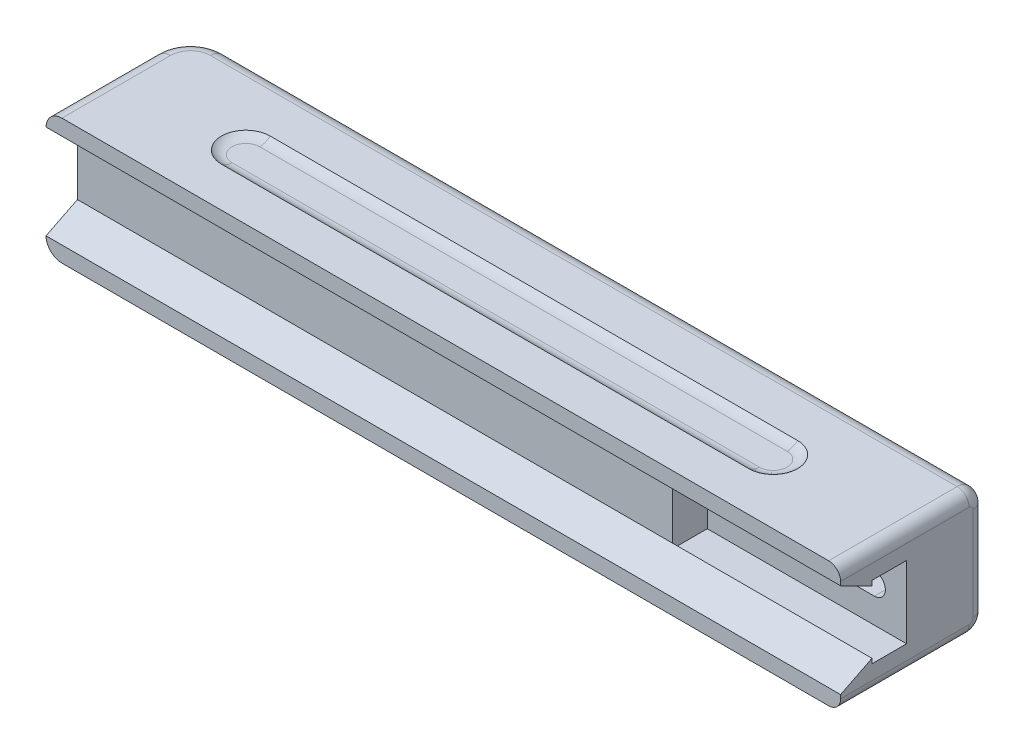
from build123d import *

# Parameters (mm, degrees)
SKETCH1_W           = 256.8448
SKETCH1_H           = 39.99738
BOSS_EXTRUDE1_DEPTH = 45.9994
CUT_EXTRUDE1_DEPTH  = 264.979140264
SKETCH3_W           = 11.01852
SKETCH3_H           = 22.9997
CUT_EXTRUDE2_DEPTH  = 67.27444
SKETCH4_R           = 3.49631
CUT_EXTRUDE3_DEPTH  = 262.138061298
CUT_EXTRUDE4_DEPTH  = 262.138061298
SKETCH6_W           = 45.9994
SKETCH6_H           = 39.99738
CUT_EXTRUDE5_DEPTH  = 3.81
FILLET1_R           = 3.81
FILLET2_R           = 11.43
FILLET3_R           = 5.08
CUT_EXTRUDE6_DEPTH  = 1.27
FILLET4_R           = 5.08
CUT_EXTRUDE7_DEPTH  = 1.27
FILLET5_R           = 5.08


with BuildPart() as part:
    # Sketch1 → Boss-Extrude1 (new body)
    with BuildSketch(Plane.XY):
        with Locations((128.4224, 19.99869)):
            Rectangle(SKETCH1_W, SKETCH1_H)
    extrude(amount=BOSS_EXTRUDE1_DEPTH)

    # Sketch2 → Cut-Extrude1 (cut, through all)
    with BuildSketch(Plane(origin=(256.8448, 0, 0), x_dir=(0, 0, -1), z_dir=(1, 0, 0))):
        Polygon((-35.99942, 9.99998), (-45.9994, 4.99872), (-45.9994, 34.99866), (-35.99942, 29.99994), align=None)
    extrude(amount=-CUT_EXTRUDE1_DEPTH, mode=Mode.SUBTRACT)

    # Sketch3 → Cut-Extrude2 (cut)
    with BuildSketch(Plane(origin=(256.8448, 0, 0), x_dir=(0, 0, -1), z_dir=(1, 0, 0))):
        with Locations((-30.49016, 19.99361)):
            Rectangle(SKETCH3_W, SKETCH3_H)
    extrude(amount=-CUT_EXTRUDE2_DEPTH, mode=Mode.SUBTRACT)

    # Sketch4 → Cut-Extrude3 (cut, through all)
    with BuildSketch(Plane.XY.offset(24.9809)):
        with Locations((198.77278, 19.99361)):
            Circle(SKETCH4_R)
    extrude(amount=-CUT_EXTRUDE3_DEPTH, mode=Mode.SUBTRACT)

    # Sketch5 → Cut-Extrude4 (cut, through all)
    with BuildSketch(Plane.XY.offset(24.9809)):
        with BuildLine():
            Line((242.77828, 23.48611), (225.78568, 23.48611))
            ThreePointArc((225.78568, 23.48611), (222.29318, 19.99361), (225.78568, 16.50111))
            Line((225.78568, 16.50111), (242.77828, 16.50111))
            ThreePointArc((242.77828, 16.50111), (246.27078, 19.99361), (242.77828, 23.48611))
        make_face()
    extrude(amount=-CUT_EXTRUDE4_DEPTH, mode=Mode.SUBTRACT)

    # Sketch6 → Cut-Extrude5 (cut)
    with BuildSketch(Plane(origin=(256.8448, 0, 0), x_dir=(0, 0, -1), z_dir=(1, 0, 0))):
        with Locations((-22.9997, 19.99869)):
            Rectangle(SKETCH6_W, SKETCH6_H)
    extrude(amount=-CUT_EXTRUDE5_DEPTH, mode=Mode.SUBTRACT)

    # Fillet1
    fillet1_edges = [part.edges().sort_by_distance(p)[0] for p in [
        (253.0348, 19.99869, 0),
        (253.0348, 0, 22.9997),
        (253.0348, 39.99738, 22.9997),
    ]]
    fillet(fillet1_edges, radius=FILLET1_R)

    # Fillet2
    fillet2_edges = [part.edges().sort_by_distance(p)[0] for p in [
        (0, 19.99869, 0),
    ]]
    fillet(fillet2_edges, radius=FILLET2_R)

    # Fillet3
    # the kernel refuses this fillet: 5.08 mm, written as the material it takes off along each edge
    with BuildSketch(Plane(origin=(253.0348, 34.91738, 5.08), x_dir=(0, 0, -1), z_dir=(0, -1, 0))) as fillet3_piece_1:
        with BuildLine():
            CenterArc((1.27, -3.81), 3.81, 0, 90)
            Line((5.08, -3.81), (5.08, 0))
            Line((5.08, 0), (1.27, 0))
        make_face()
    revolve(axis=Axis((253.0348, 34.91738, 5.08), (1, 0, 0)), revolution_arc=90, mode=Mode.SUBTRACT)
    with BuildSketch(Plane(origin=(253.0348, 5.08, 5.08), x_dir=(0, -1, 0), z_dir=(0, 0, 1))) as fillet3_piece_2:
        with BuildLine():
            CenterArc((1.27, -3.81), 3.81, 0, 90)
            Line((5.08, -3.81), (5.08, 0))
            Line((5.08, 0), (1.27, 0))
        make_face()
    revolve(axis=Axis((253.0348, 5.08, 5.08), (1, 0, 0)), revolution_arc=90, mode=Mode.SUBTRACT)
    with BuildSketch(Plane(origin=(0, 0, 11.43), x_dir=(1, 0, 0), z_dir=(0, 0, 1)), Plane(origin=(0, 39.99738, 11.43), x_dir=(0, -1, 0), z_dir=(0, 0, 1))) as fillet3_piece_3:
        with BuildLine():
            CenterArc((FILLET3_R, FILLET3_R), FILLET3_R, 180, 90)
            Line((0, FILLET3_R), (0, 0))
            Line((0, 0), (FILLET3_R, 0))
        make_face()
    extrude(amount=47.2694, mode=Mode.SUBTRACT)
    with BuildSketch(Plane(origin=(11.43, 0, 11.43), x_dir=(0, 0, -1), z_dir=(1, 0, 0))) as fillet3_piece_4:
        with BuildLine():
            CenterArc((11.43 - FILLET3_R, FILLET3_R), FILLET3_R, 270, 90)
            Line((11.43, FILLET3_R), (11.43, 0))
            Line((11.43, 0), (11.43 - FILLET3_R, 0))
        make_face()
    revolve(axis=Axis((11.43, 0, 11.43), (0, 1, 0)), revolution_arc=90, mode=Mode.SUBTRACT)
    with BuildSketch(Plane(origin=(11.43, 39.99738, 11.43), x_dir=(0, 0, -1), z_dir=(1, 0, 0))) as fillet3_piece_5:
        with BuildLine():
            CenterArc((11.43 - FILLET3_R, -FILLET3_R), FILLET3_R, 0, 90)
            Line((11.43 - FILLET3_R, 0), (11.43, 0))
            Line((11.43, 0), (11.43, -FILLET3_R))
        make_face()
    revolve(axis=Axis((11.43, 39.99738, 11.43), (0, 1, 0)), revolution_arc=90, mode=Mode.SUBTRACT)
    with BuildSketch(Plane(origin=(11.43, 0, 0), x_dir=(0, 0, 1), z_dir=(1, 0, 0))) as fillet3_piece_6:
        with BuildLine():
            CenterArc((FILLET3_R, -FILLET3_R), FILLET3_R, 90, 90)
            Line((0, -FILLET3_R), (0, 0))
            Line((0, 0), (FILLET3_R, 0))
        make_face()
    extrude(amount=241.6048, mode=Mode.SUBTRACT)
    with BuildSketch(Plane(origin=(253.0348, 39.99738, 0), x_dir=(0, -1, 0), z_dir=(-1, 0, 0))) as fillet3_piece_7:
        with BuildLine():
            CenterArc((FILLET3_R, FILLET3_R), FILLET3_R, 180, 90)
            Line((0, FILLET3_R), (0, 0))
            Line((0, 0), (FILLET3_R, 0))
        make_face()
    extrude(amount=241.6048, mode=Mode.SUBTRACT)

    # Sketch7 → Cut-Extrude6 (cut)
    with BuildSketch(Plane(origin=(0, 39.99738, 0), x_dir=(1, 0, 0), z_dir=(0, 1, 0))):
        with BuildLine():
            Line((211.1248, -33.2994), (43.18, -33.2994))
            ThreePointArc((43.18, -33.2994), (35.4203, -25.5397), (43.18, -17.78))
            Line((43.18, -17.78), (211.1248, -17.78))
            ThreePointArc((211.1248, -17.78), (218.8845, -25.5397), (211.1248, -33.2994))
        make_face()
    extrude(amount=-CUT_EXTRUDE6_DEPTH, mode=Mode.SUBTRACT)

    # Fillet4
    # the kernel refuses this fillet: 5.08 mm, written as the material it adds along each edge
    with BuildSketch(Plane(origin=(211.1248, 38.72738, 33.2994), x_dir=(0, 1, 0), z_dir=(-1, 0, 0)), Plane(origin=(43.18, 38.72738, 17.78), x_dir=(0, 1, 0), z_dir=(1, 0, 0))) as fillet4_piece_1:
        with BuildLine():
            CenterArc((5.08, 3.360104165), FILLET4_R, 180, 41.409622109)
            Line((0, 3.360104165), (-0.1016, 3.360104165))
            Line((-0.1016, 3.360104165), (-0.1016, 0))
            Line((-0.1016, 0), (0, -0.1016))
            ThreePointArc((0, -0.1016), (0.635, -0.1016), (1.1938, -0.067202083))
            Line((1.1938, -0.067202083), (1.27, 0))
        make_face()
    extrude(amount=167.9448)
    with BuildSketch(Plane(origin=(43.18, 38.72738, 25.5397), x_dir=(0, 0, 1), z_dir=(1, 0, 0))) as fillet4_piece_2:
        with BuildLine():
            CenterArc((4.399595835, -5.08), FILLET4_R, 48.590377891, 41.409622109)
            Line((4.399595835, 0), (4.399595835, 0.1016))
            Line((4.399595835, 0.1016), (7.7597, 0.1016))
            Line((7.7597, 0.1016), (7.8613, 0))
            ThreePointArc((7.8613, 0), (7.8613, -0.635), (7.826902083, -1.1938))
            Line((7.826902083, -1.1938), (7.7597, -1.27))
        make_face()
    revolve(axis=Axis((43.18, 38.72738, 25.5397), (0, -1, 0)), revolution_arc=180)
    with BuildSketch(Plane(origin=(211.1248, 38.72738, 25.5397), x_dir=(0, 0, -1), z_dir=(-1, 0, 0))) as fillet4_piece_3:
        with BuildLine():
            CenterArc((4.399595835, -5.08), FILLET4_R, 48.590377891, 41.409622109)
            Line((4.399595835, 0), (4.399595835, 0.1016))
            Line((4.399595835, 0.1016), (7.7597, 0.1016))
            Line((7.7597, 0.1016), (7.8613, 0))
            ThreePointArc((7.8613, 0), (7.8613, -0.635), (7.826902083, -1.1938))
            Line((7.826902083, -1.1938), (7.7597, -1.27))
        make_face()
    revolve(axis=Axis((211.1248, 38.72738, 25.5397), (0, -1, 0)), revolution_arc=180)

    # Sketch8 → Cut-Extrude7 (cut)
    with BuildSketch(Plane.XZ):
        with BuildLine():
            Line((43.18, 33.2994), (211.1248, 33.2994))
            ThreePointArc((211.1248, 33.2994), (218.8845, 25.5397), (211.1248, 17.78))
            Line((211.1248, 17.78), (43.18, 17.78))
            ThreePointArc((43.18, 17.78), (35.4203, 25.5397), (43.18, 33.2994))
        make_face()
    extrude(amount=-CUT_EXTRUDE7_DEPTH, mode=Mode.SUBTRACT)

    # Fillet5
    # the kernel refuses this fillet: 5.08 mm, written as the material it adds along each edge
    with BuildSketch(Plane(origin=(43.18, 1.27, 33.2994), x_dir=(0, -1, 0), z_dir=(1, 0, 0)), Plane(origin=(211.1248, 1.27, 17.78), x_dir=(0, -1, 0), z_dir=(-1, 0, 0))) as fillet5_piece_1:
        with BuildLine():
            CenterArc((5.08, 3.360104165), FILLET5_R, 180, 41.409622109)
            Line((0, 3.360104165), (-0.1016, 3.360104165))
            Line((-0.1016, 3.360104165), (-0.1016, 0))
            Line((-0.1016, 0), (0, -0.1016))
            ThreePointArc((0, -0.1016), (0.635, -0.1016), (1.1938, -0.067202083))
            Line((1.1938, -0.067202083), (1.27, 0))
        make_face()
    extrude(amount=167.9448)
    with BuildSketch(Plane(origin=(211.1248, 1.27, 25.5397), x_dir=(0, 0, 1), z_dir=(-1, 0, 0))) as fillet5_piece_2:
        with BuildLine():
            CenterArc((4.399595835, -5.08), FILLET5_R, 48.590377891, 41.409622109)
            Line((4.399595835, 0), (4.399595835, 0.1016))
            Line((4.399595835, 0.1016), (7.7597, 0.1016))
            Line((7.7597, 0.1016), (7.8613, 0))
            ThreePointArc((7.8613, 0), (7.8613, -0.635), (7.826902083, -1.1938))
            Line((7.826902083, -1.1938), (7.7597, -1.27))
        make_face()
    revolve(axis=Axis((211.1248, 1.27, 25.5397), (0, 1, 0)), revolution_arc=180)
    with BuildSketch(Plane(origin=(43.18, 1.27, 25.5397), x_dir=(0, 0, -1), z_dir=(1, 0, 0))) as fillet5_piece_3:
        with BuildLine():
            CenterArc((4.399595835, -5.08), FILLET5_R, 48.590377891, 41.409622109)
            Line((4.399595835, 0), (4.399595835, 0.1016))
            Line((4.399595835, 0.1016), (7.7597, 0.1016))
            Line((7.7597, 0.1016), (7.8613, 0))
            ThreePointArc((7.8613, 0), (7.8613, -0.635), (7.826902083, -1.1938))
            Line((7.826902083, -1.1938), (7.7597, -1.27))
        make_face()
    revolve(axis=Axis((43.18, 1.27, 25.5397), (0, 1, 0)), revolution_arc=180)


solid = part.part
